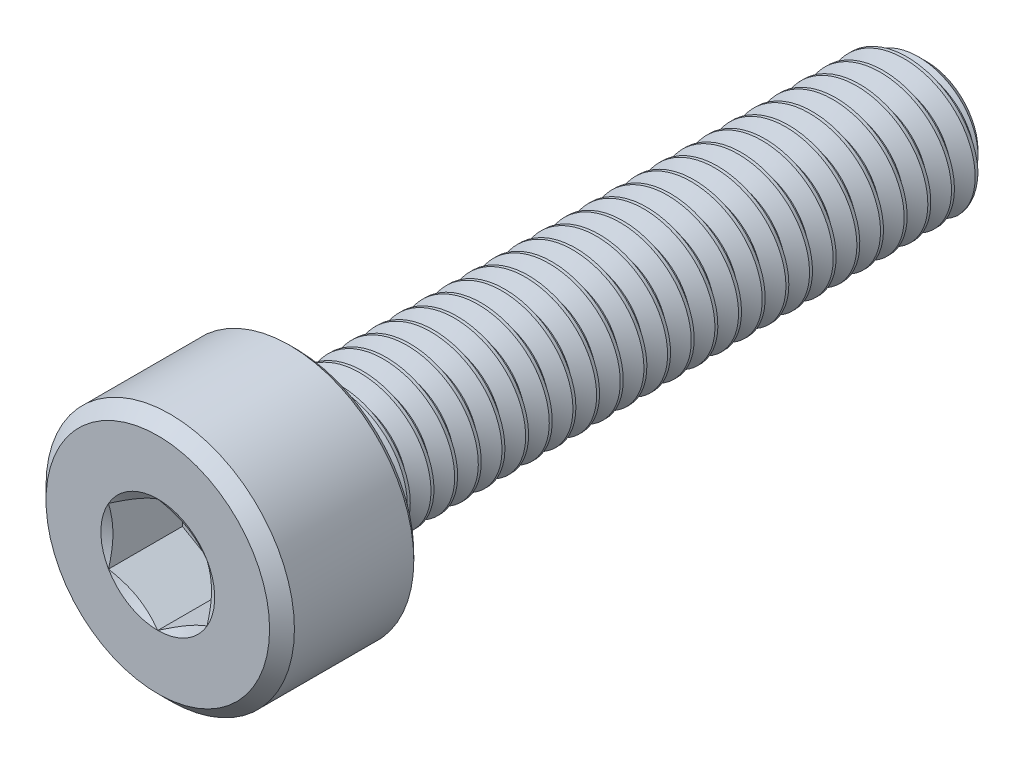
from build123d import *

# Parameters (mm, degrees)
CUT_EXTRUDE1_DEPTH = 1.875
CHAMFER1_SIZE      = 0.315
CHAMFER2_SIZE      = 0.1575
CUT_SWEEP1_PITCH   = 0.6


with BuildPart() as part:
    # Sketch2 → Revolve1 (revolve)
    with BuildSketch(Plane(origin=(0, 0, 0), x_dir=(0, 0, -1), z_dir=(1, 0, 0)), mode=Mode.PRIVATE) as revolve1_sk:
        Polygon((9.75, 1.3), (9.3, 1.75), (-6.25, 1.75), (-6.25, 3.15), (-9.75, 3.15), (-9.75, 0), (9.75, 0), align=None)
    revolve(revolve1_sk.sketch.rotate(Axis((0, 0, -9.75), (0, 0, 1)), 90), axis=Axis((0, 0, -9.75), (0, 0, 1)))

    # Sketch4 → Cut-Extrude1 (cut)
    with BuildSketch(Plane.XY.offset(9.75)):
        Polygon((0, 1.443375673), (-1.25, 0.721687836), (-1.25, -0.721687836), (0, -1.443375673), (1.25, -0.721687836), (1.25, 0.721687836), align=None)
    extrude(amount=-CUT_EXTRUDE1_DEPTH, mode=Mode.SUBTRACT)

    # Cut-Extrude2 cone 1 section (through the dimple's axis) → Cut-Extrude2 (revolve, cut)
    with BuildSketch(Plane(origin=(0, 0, 9.75), x_dir=(0, -1, 0), z_dir=(1, 0, 0))):
        Polygon((0, 0), (1.443375673, 0), (0, 0.833333333), align=None)
    revolve(axis=Axis((0, 0, 9.75), (0, 0, -1)), mode=Mode.SUBTRACT)

    # Chamfer1
    chamfer1_edges = [part.edges().sort_by_distance(p)[0] for p in [
        (3.15, 0, 9.75),
    ]]
    chamfer(chamfer1_edges, length=CHAMFER1_SIZE)

    # Chamfer2
    chamfer2_edges = [part.edges().sort_by_distance(p)[0] for p in [
        (3.15, 0, 6.25),
    ]]
    chamfer(chamfer2_edges, length=CHAMFER2_SIZE)

    # Cut-Sweep1: the profile of Sketch7 profile screwed along a right-hand helix of 27.166667 turns, 6 arcs to a turn; built about Z, then put on its axis
    cut_sweep1_z = Axis((0, 0, 0), (0, 0, 1))
    cut_sweep1_corners = [(1.7503, 0, 0.000173205), (1.7503, 0, -0.525173205), (1.360288568, 0, -0.3), (1.360288568, 0, -0.225)]
    with BuildLine(mode=Mode.PRIVATE) as cut_sweep1_profile:
        Line(cut_sweep1_corners[0], cut_sweep1_corners[1])
        Line(cut_sweep1_corners[1], cut_sweep1_corners[2])
        Line(cut_sweep1_corners[2], cut_sweep1_corners[3])
        Line(cut_sweep1_corners[3], cut_sweep1_corners[0])
    cut_sweep1_cap = Face(cut_sweep1_profile.wire())
    cut_sweep1_turn_angles = [0, 30, 60, 90, 120, 150, 180, 210, 240, 270, 300, 330, 360]
    cut_sweep1_turn_weights = [1, 0.8660254037844387, 1, 0.8660254037844387, 1, 0.8660254037844387, 1, 0.8660254037844387, 1, 0.8660254037844387, 1, 0.8660254037844387, 1]
    cut_sweep1_turn_rails = [Edge.make_bspline([Vector(p[0], p[1], 0).rotate(cut_sweep1_z, cut_sweep1_turn_angles[k]) / cut_sweep1_turn_weights[k] + Vector(0, 0, p[2] + CUT_SWEEP1_PITCH * cut_sweep1_turn_angles[k] / 360) for k in range(13)], [0, 0, 0, 1, 1, 2, 2, 3, 3, 4, 4, 5, 5, 6, 6, 6], 2, cut_sweep1_turn_weights) for p in cut_sweep1_corners]
    cut_sweep1_turn_sides = [Face.make_surface_from_curves(cut_sweep1_turn_rails[p[0]], cut_sweep1_turn_rails[p[1]]) for p in [(0, 1), (1, 2), (2, 3), (3, 0)]]
    cut_sweep1_last_angles = [9720, 9750, 9780]
    cut_sweep1_last_weights = [1, 0.8660254037852323, 1]
    cut_sweep1_last_rails = [Edge.make_bspline([Vector(p[0], p[1], 0).rotate(cut_sweep1_z, cut_sweep1_last_angles[k]) / cut_sweep1_last_weights[k] + Vector(0, 0, p[2] + CUT_SWEEP1_PITCH * cut_sweep1_last_angles[k] / 360) for k in range(3)], [0, 0, 0, 1, 1, 1], 2, cut_sweep1_last_weights) for p in cut_sweep1_corners]
    cut_sweep1_last_sides = [Face.make_surface_from_curves(cut_sweep1_last_rails[p[0]], cut_sweep1_last_rails[p[1]]) for p in [(0, 1), (1, 2), (2, 3), (3, 0)]]
    cut_sweep1 = Plane(origin=(0, 0, -9.75), x_dir=(0, 1, 0), z_dir=(0, 0, 1)) * Solid(Shell([*[p.moved(Location((0, 0, CUT_SWEEP1_PITCH * i))) for i in range(27) for p in cut_sweep1_turn_sides], *cut_sweep1_last_sides, cut_sweep1_cap, cut_sweep1_cap.rotate(cut_sweep1_z, 9780).moved(Location((0, 0, CUT_SWEEP1_PITCH * 9780 / 360)))]))
    add(cut_sweep1, mode=Mode.SUBTRACT)

    # Sketch8 → Revolve2 (revolve)
    with BuildSketch(Plane(origin=(0, 0, 0), x_dir=(0, 0, -1), z_dir=(1, 0, 0)), mode=Mode.PRIVATE) as revolve2_sk:
        Polygon((-7.875, 0), (-7.875, 1.782475953), (-5.95, 1.782475953), (-4.920887029, 0), align=None)
    revolve(revolve2_sk.sketch.rotate(Axis((0, 0, 4.920887029), (0, 0, 1)), 270), axis=Axis((0, 0, 4.920887029), (0, 0, 1)))


solid = part.part
